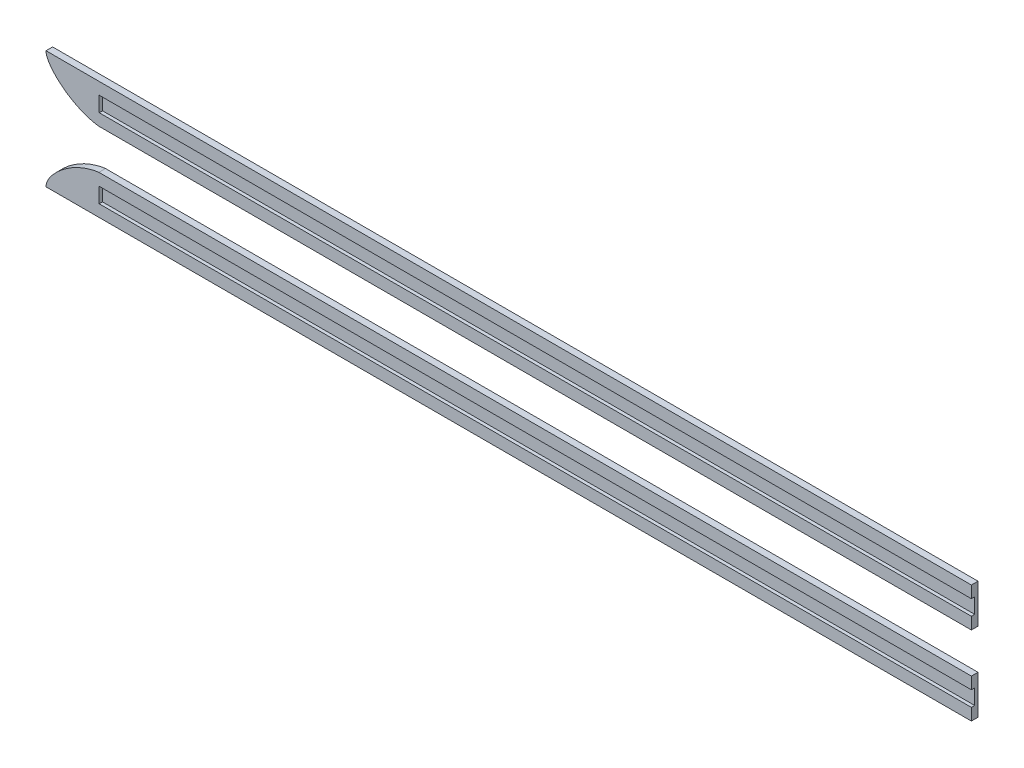
from build123d import *

# Parameters (mm, degrees)
EXTRUDE_1_DEPTH     = 5
SKETCH_3_W          = 660
SKETCH_3_H          = 11.49205482
CUT_EXTRUDE_1_DEPTH = 2.5


with BuildPart() as part:
    # 草图2 → 凸台-拉伸1 (new body)
    with BuildSketch(Plane.XY):
        with BuildLine():
            Line((-82.896451901, 44.580601224), (617.103548099, 44.580601224))
            Line((617.103548099, 44.580601224), (617.103548099, 15.088546404))
            Line((617.103548099, 15.088546404), (-42.893, 15.088546404))
            add(Edge.make_bspline(
                [(-82.896451901, 44.580601224), (-83.095169451, 35.767375392), (-64.158209505, 17.751408581), (-42.893, 15.088546404)],
                knots=[0, 0, 0, 0, 1, 1, 1, 1], degree=3))
        make_face()
    extrude(amount=EXTRUDE_1_DEPTH)

    # 草图3 → 切除-拉伸1 (cut)
    with BuildSketch(Plane.XY.offset(5)):
        with Locations((287.380589783, 29.834573814)):
            Rectangle(SKETCH_3_W, SKETCH_3_H)
    extrude(amount=-CUT_EXTRUDE_1_DEPTH, mode=Mode.SUBTRACT)


with BuildPart() as body_2:
    # 镜向9: mirrored copy
    add(part.part.mirror(Plane.ZX))


solid = Compound([part.part, body_2.part])
